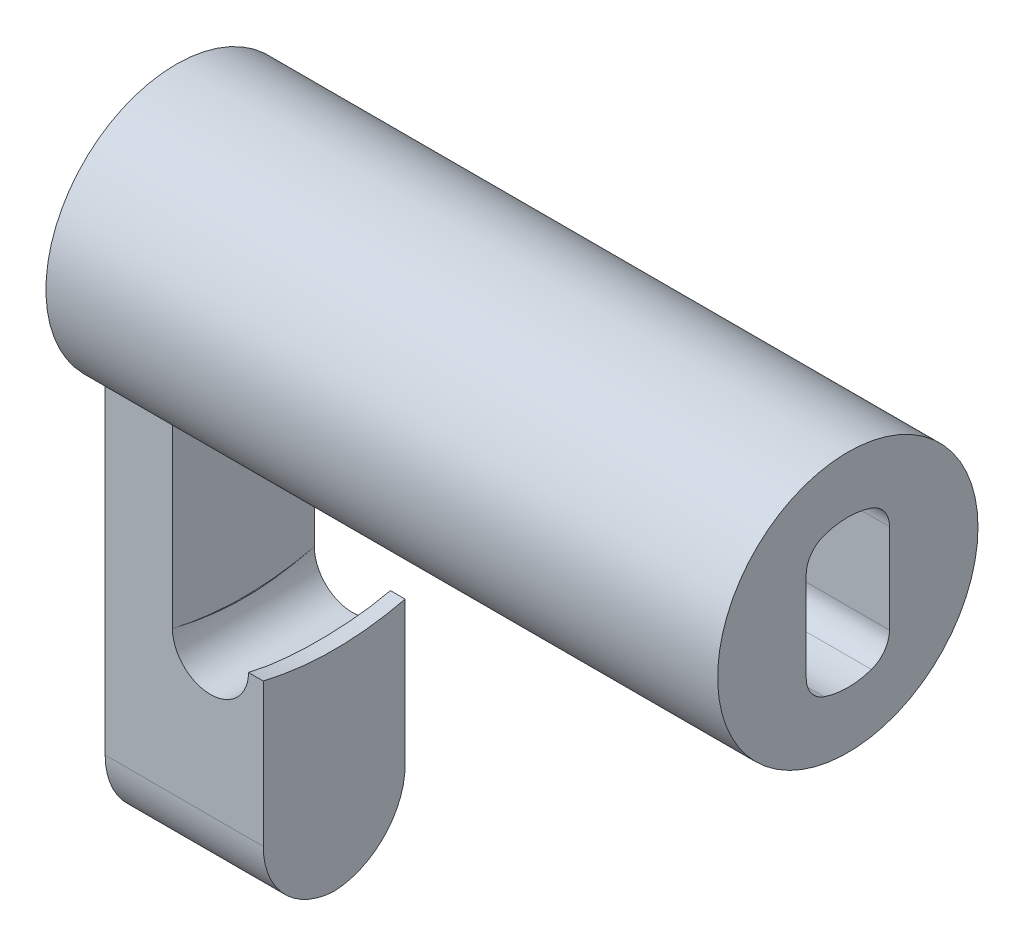
from build123d import *

# Parameters (mm, degrees)
SKETCH1_R           = 8.7376
BOSS_EXTRUDE1_DEPTH = 45.085
BOSS_EXTRUDE3_DEPTH = 4.516000112
FILLET2_R           = 5
BOSS_EXTRUDE4_DEPTH = 6.096
CUT_EXTRUDE8_DEPTH  = 6.096
CUT_EXTRUDE10_DEPTH = 12.192
FILLET11_R          = 1.778
SKETCH25_R          = 2.5527
CUT_EXTRUDE14_DEPTH = 59.077319733
CUT_EXTRUDE15_DEPTH = 9.525
FILLET12_R          = 1.5875


with BuildPart() as part:
    # Sketch1 → Boss-Extrude1 (new body)
    with BuildSketch(Plane.YZ):
        with Locations(Location((0, 0, 0), (0, 0, 270))):
            Circle(SKETCH1_R)
    extrude(amount=BOSS_EXTRUDE1_DEPTH)

    # Sketch10 → Boss-Extrude3 (add)
    with BuildSketch(Plane(origin=(0, 0, 0), x_dir=(0, -1, 0), z_dir=(-1, 0, 0))):
        with BuildLine():
            Line((7.325588544, 4.7625), (34.036, 4.7625))
            Line((34.036, 4.7625), (34.036, -4.7625))
            Line((34.036, -4.7625), (7.325588544, -4.7625))
            ThreePointArc((7.325588544, -4.7625), (8.7376, 0), (7.325588544, 4.7625))
        make_face()
    extrude(amount=-BOSS_EXTRUDE3_DEPTH)

    # Fillet2
    # the kernel refuses this fillet: 5 mm, written as the material it takes off along each edge
    with BuildSketch(Plane(origin=(-12.5, -34.036, 4.7625), x_dir=(0, 1, 0), z_dir=(1, 0, 0))) as fillet2_piece_1:
        with BuildLine():
            CenterArc((FILLET2_R, -FILLET2_R), FILLET2_R, 90, 90)
            Line((0, -FILLET2_R), (0, 0))
            Line((0, 0), (FILLET2_R, 0))
        make_face()
    extrude(amount=29.516000112, mode=Mode.SUBTRACT)
    with BuildSketch(Plane(origin=(-12.5, -34.036, -4.7625), x_dir=(0, 1, 0), z_dir=(1, 0, 0))) as fillet2_piece_2:
        with BuildLine():
            CenterArc((FILLET2_R, FILLET2_R), FILLET2_R, 180, 90)
            Line((0, FILLET2_R), (0, 0))
            Line((0, 0), (FILLET2_R, 0))
        make_face()
    extrude(amount=29.516000112, mode=Mode.SUBTRACT)

    # Sketch15 → Boss-Extrude4 (add)
    with BuildSketch(Plane.YZ.offset(4.516000112)):
        with BuildLine():
            Line((-18.79035619, -4.7625), (-18.79035619, 4.7625))
            Line((-18.79035619, 4.7625), (-29.036, 4.7625))
            ThreePointArc((-29.036, 4.7625), (-32.486543435, 3.381028707), (-34.03035619, 0))
            ThreePointArc((-34.03035619, 0), (-32.486543435, -3.381028707), (-29.036, -4.7625))
            Line((-29.036, -4.7625), (-18.79035619, -4.7625))
        make_face()
    extrude(amount=BOSS_EXTRUDE4_DEPTH)

    # Sketch21 → Cut-Extrude8 (cut)
    with BuildSketch(Plane.YZ.offset(10.612000112)):
        with BuildLine():
            Line((-19.42535619, -4.7625), (-18.79035619, -4.7625))
            Line((-18.79035619, -4.7625), (-18.79035619, 4.7625))
            Line((-18.79035619, 4.7625), (-19.42535619, 4.7625))
            ThreePointArc((-19.42535619, 4.7625), (-19.991344097, 0), (-19.42535619, -4.7625))
        make_face()
    extrude(amount=-CUT_EXTRUDE8_DEPTH, mode=Mode.SUBTRACT)

    # Sketch22 → Cut-Extrude10 (cut)
    with BuildSketch(Plane.YZ.offset(45.085)):
        with BuildLine():
            Line((-4.089715516, -2.794), (4.089715516, -2.794))
            ThreePointArc((4.089715516, -2.794), (4.953, 0), (4.089715516, 2.794))
            Line((4.089715516, 2.794), (-4.089715516, 2.794))
            ThreePointArc((-4.089715516, 2.794), (-4.953, 0), (-4.089715516, -2.794))
        make_face()
    extrude(amount=-CUT_EXTRUDE10_DEPTH, mode=Mode.SUBTRACT)

    # Fillet11
    fillet11_edges = [part.edges().sort_by_distance(p)[0] for p in [
        (38.989, 4.089715516, 2.794),
        (38.989, 4.089715516, -2.794),
        (38.989, -4.089715516, -2.794),
        (38.989, -4.089715516, 2.794),
    ]]
    fillet(fillet11_edges, radius=FILLET11_R)

    # Sketch25 → Cut-Extrude14 (cut, through all)
    with BuildSketch(Plane(origin=(0, 0, -4.7625), x_dir=(1, 0, 0), z_dir=(0, 0, -1))):
        with Locations((7.068700112, 19.42535619)):
            Circle(SKETCH25_R)
    extrude(amount=-CUT_EXTRUDE14_DEPTH, mode=Mode.SUBTRACT)

    # Sketch26 → Cut-Extrude15 (cut)
    with BuildSketch(Plane(origin=(0, 0, 0), x_dir=(0, -1, 0), z_dir=(-1, 0, 0))):
        with BuildLine():
            Line((3.684641875, 1.7145), (7.177141875, 1.7145))
            Line((7.177141875, 1.7145), (7.177141875, -1.7145))
            Line((7.177141875, -1.7145), (3.684641875, -1.7145))
            ThreePointArc((3.684641875, -1.7145), (-4.064, 0), (3.684641875, 1.7145))
        make_face()
    extrude(amount=-CUT_EXTRUDE15_DEPTH, mode=Mode.SUBTRACT)

    # Fillet12
    fillet12_edges = [part.edges().sort_by_distance(p)[0] for p in [
        (4.7625, -3.684641875, -1.7145),
        (4.7625, -3.684641875, 1.7145),
        (4.7625, -7.177141875, 1.7145),
        (4.7625, -7.177141875, -1.7145),
    ]]
    fillet(fillet12_edges, radius=FILLET12_R)


solid = part.part
